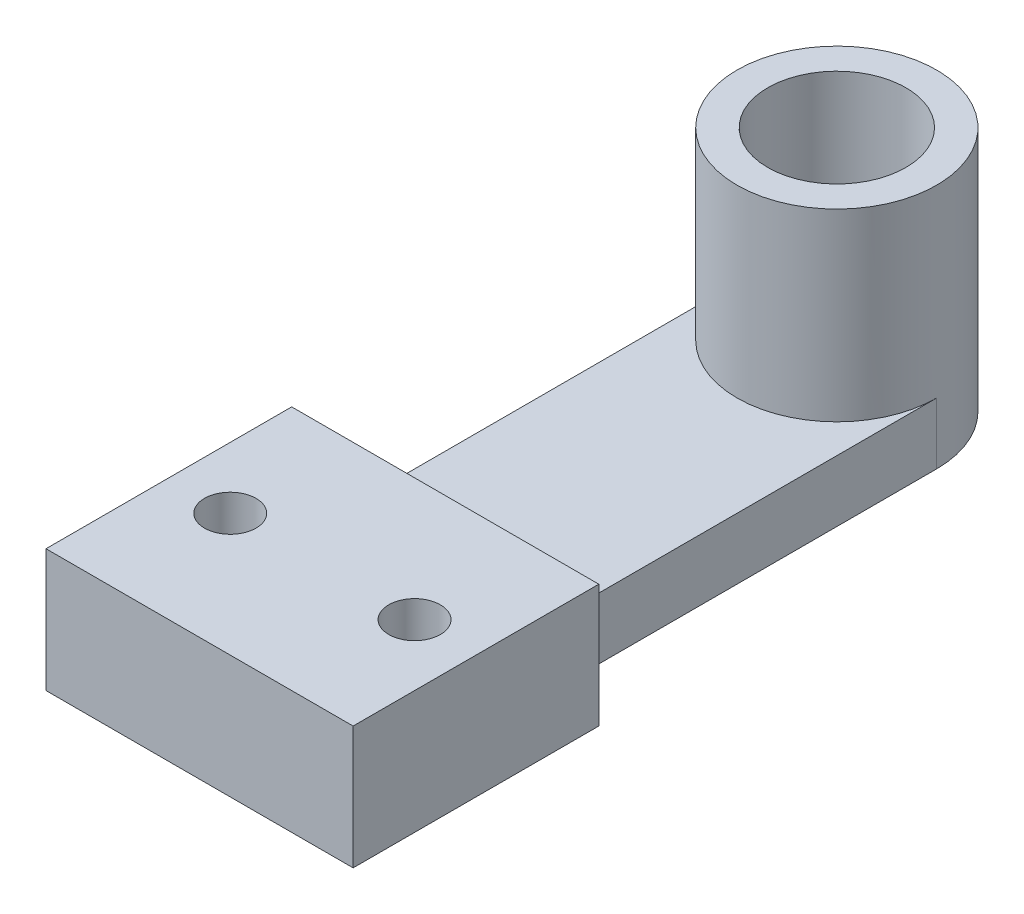
from build123d import *

# Parameters (mm, degrees)
SKETCH1_R           = 2.1
BOSS_EXTRUDE1_DEPTH = 5
SKETCH1_3_R         = 2.1
BOSS_EXTRUDE2_DEPTH = 10
SKETCH1_4_R         = 5.625
BOSS_EXTRUDE3_DEPTH = 20


with BuildPart() as part:
    # Sketch1 → Boss-Extrude1 (new body)
    with BuildSketch(Plane(origin=(0, 0, 0), x_dir=(1, 0, 0), z_dir=(0, 1, 0))):
        with BuildLine():
            Line((-12.5, 10), (-12.5, -10))
            Line((-12.5, -10), (12.5, -10))
            Line((12.5, -10), (12.5, 10))
            Line((12.5, 10), (8.125, 10))
            Line((8.125, 10), (8.125, 41.875))
            ThreePointArc((8.125, 41.875), (0, 50), (-8.125, 41.875))
            Line((-8.125, 41.875), (-8.125, 10))
            Line((-8.125, 10), (-12.5, 10))
        make_face()
        with Locations((-7.5, 0)):
            Circle(SKETCH1_R, mode=Mode.SUBTRACT)
        with Locations((7.5, 0)):
            Circle(SKETCH1_R, mode=Mode.SUBTRACT)
    extrude(amount=BOSS_EXTRUDE1_DEPTH)

    # Sketch1<3> → Boss-Extrude2 (add)
    with BuildSketch(Plane(origin=(0, 0, 0), x_dir=(1, 0, 0), z_dir=(0, 1, 0))):
        Polygon((-12.5, 10), (-12.5, -10), (12.5, -10), (12.5, 10), (8.125, 10), (-8.125, 10), align=None)
        with Locations((-7.5, 0)):
            Circle(SKETCH1_3_R, mode=Mode.SUBTRACT)
        with Locations((7.5, 0)):
            Circle(SKETCH1_3_R, mode=Mode.SUBTRACT)
    extrude(amount=BOSS_EXTRUDE2_DEPTH)

    # Sketch1<4> → Boss-Extrude3 (add)
    with BuildSketch(Plane(origin=(0, 0, 0), x_dir=(1, 0, 0), z_dir=(0, 1, 0))):
        with BuildLine():
            ThreePointArc((0, 50), (-5.745242597, 47.620242597), (-8.125, 41.875))
            ThreePointArc((-8.125, 41.875), (0, 33.75), (8.125, 41.875))
            ThreePointArc((8.125, 41.875), (5.745242597, 47.620242597), (0, 50))
        make_face()
        with Locations((0, 41.875)):
            Circle(SKETCH1_4_R, mode=Mode.SUBTRACT)
    extrude(amount=BOSS_EXTRUDE3_DEPTH)


solid = part.part
